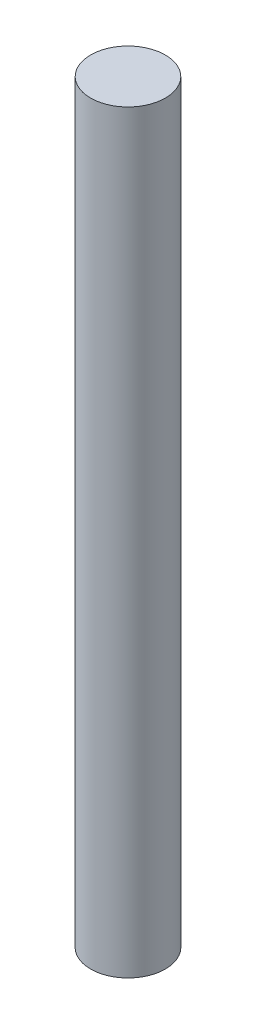
from build123d import *

# Parameters (mm, degrees)
SKETCH1_R           = 5
BOSS_EXTRUDE1_DEPTH = 100.96


with BuildPart() as part:
    # Sketch1 → Boss-Extrude1 (new body)
    with BuildSketch(Plane(origin=(0, 0, 0), x_dir=(1, 0, 0), z_dir=(0, 1, 0))):
        Circle(SKETCH1_R)
    extrude(amount=BOSS_EXTRUDE1_DEPTH)


solid = part.part
